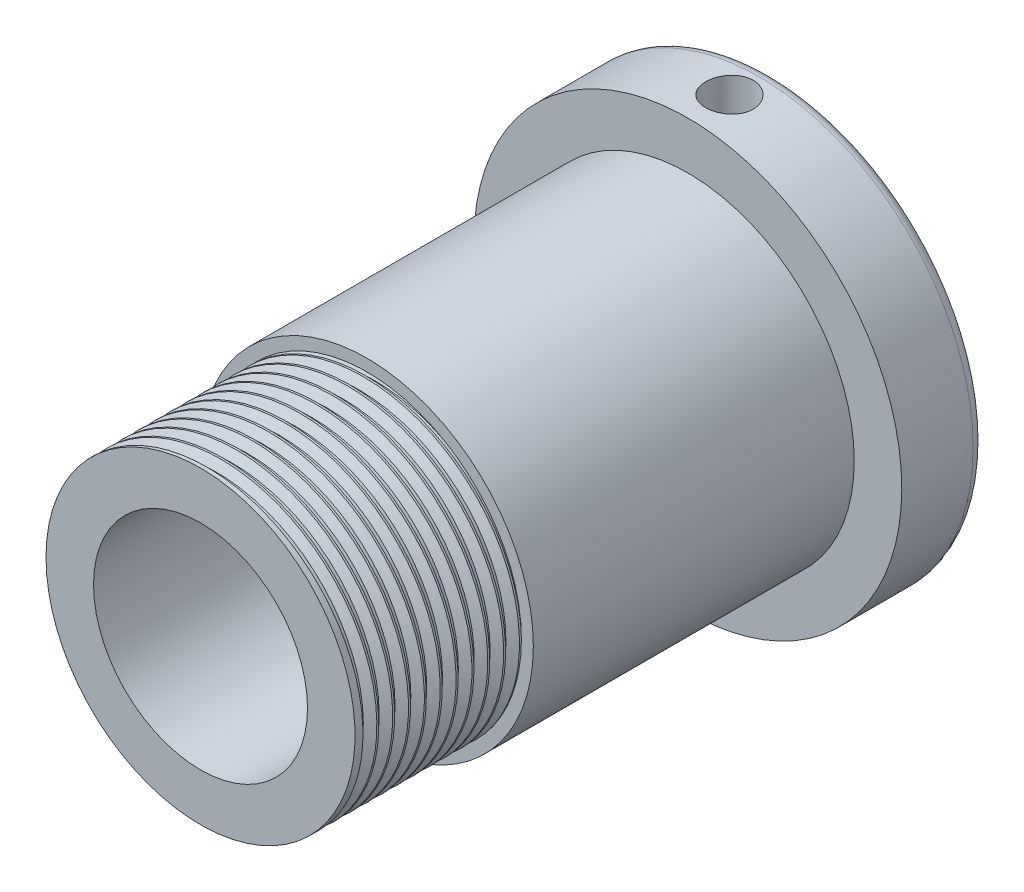
from build123d import *

# Parameters (mm, degrees)
SKETCH5_R          = 14.2875
CUT_EXTRUDE1_DEPTH = 87.252543441
SKETCH6_R          = 3.175
CUT_EXTRUDE2_DEPTH = 9.525
FILLET1_R          = 1.5875
THREAD1_PITCH      = 2.116666667


with BuildPart() as part:
    # Sketch1 → Revolve1 (revolve)
    with BuildSketch(Plane(origin=(0, 0, 0), x_dir=(0, 0, -1), z_dir=(1, 0, 0)), mode=Mode.PRIVATE) as revolve1_sk:
        Polygon((38.951396648, 28.575), (38.951396648, 0), (-37.248603352, 0), (-37.248603352, 20.6375), (-15.023603352, 20.6375), (-15.023603352, 22.225), (27.838896648, 22.225), (27.838896648, 28.575), align=None)
    revolve(revolve1_sk.sketch.rotate(Axis((0, 0, 27.688128492), (0, 0, -1)), 90), axis=Axis((0, 0, 27.688128492), (0, 0, -1)))

    # Sketch5 → Cut-Extrude1 (cut, through all)
    with BuildSketch(Plane.XY.offset(37.248603352)):
        Circle(SKETCH5_R)
    extrude(amount=-CUT_EXTRUDE1_DEPTH, mode=Mode.SUBTRACT)

    # Sketch6 → Cut-Extrude2 (cut)
    with BuildSketch(Plane(origin=(0, 28.575, 0), x_dir=(1, 0, 0), z_dir=(0, 1, 0))):
        with Locations(Location((0, 33.395146648, 0), (0, 0, 270))):
            Circle(SKETCH6_R)
    extrude(amount=-CUT_EXTRUDE2_DEPTH, mode=Mode.SUBTRACT)

    # Fillet1
    fillet1_edges = [part.edges().sort_by_distance(p)[0] for p in [
        (-28.575, 0, -38.951396648),
    ]]
    fillet(fillet1_edges, radius=FILLET1_R)

    # Thread1: the profile of Thread Profile1 profile screwed along a right-hand helix of 10.5 turns, 10 arcs to a turn; built about Z, then put on its axis
    thread1_z = Axis((0, 0, 0), (0, 0, 1))
    thread1_corners = [(20.6378, 0, -0.000173205), (20.6378, 0, 1.852256533), (19.491820565, 0, 1.190624997), (19.491820565, 0, 0.66145833)]
    with BuildLine(mode=Mode.PRIVATE) as thread1_profile:
        Line(thread1_corners[0], thread1_corners[1])
        Line(thread1_corners[1], thread1_corners[2])
        Line(thread1_corners[2], thread1_corners[3])
        Line(thread1_corners[3], thread1_corners[0])
    thread1_cap = Face(thread1_profile.wire())
    thread1_turn_angles = [0, 18, 36, 54, 72, 90, 108, 126, 144, 162, 180, 198, 216, 234, 252, 270, 288, 306, 324, 342, 360]
    thread1_turn_weights = [1, 0.9510565162951535, 1, 0.9510565162951535, 1, 0.9510565162951535, 1, 0.9510565162951535, 1, 0.9510565162951535, 1, 0.9510565162951535, 1, 0.9510565162951535, 1, 0.9510565162951535, 1, 0.9510565162951535, 1, 0.9510565162951535, 1]
    thread1_turn_rails = [Edge.make_bspline([Vector(p[0], p[1], 0).rotate(thread1_z, thread1_turn_angles[k]) / thread1_turn_weights[k] + Vector(0, 0, p[2] + THREAD1_PITCH * thread1_turn_angles[k] / 360) for k in range(21)], [0, 0, 0, 1, 1, 2, 2, 3, 3, 4, 4, 5, 5, 6, 6, 7, 7, 8, 8, 9, 9, 10, 10, 10], 2, thread1_turn_weights) for p in thread1_corners]
    thread1_turn_sides = [Face.make_surface_from_curves(thread1_turn_rails[p[0]], thread1_turn_rails[p[1]]) for p in [(0, 1), (1, 2), (2, 3), (3, 0)]]
    thread1_last_angles = [3600, 3618, 3636, 3654, 3672, 3690, 3708, 3726, 3744, 3762, 3780]
    thread1_last_weights = [1, 0.9510565162951535, 1, 0.9510565162951535, 1, 0.9510565162951535, 1, 0.9510565162951535, 1, 0.9510565162951523, 1]
    thread1_last_rails = [Edge.make_bspline([Vector(p[0], p[1], 0).rotate(thread1_z, thread1_last_angles[k]) / thread1_last_weights[k] + Vector(0, 0, p[2] + THREAD1_PITCH * thread1_last_angles[k] / 360) for k in range(11)], [0, 0, 0, 1, 1, 2, 2, 3, 3, 4, 4, 5, 5, 5], 2, thread1_last_weights) for p in thread1_corners]
    thread1_last_sides = [Face.make_surface_from_curves(thread1_last_rails[p[0]], thread1_last_rails[p[1]]) for p in [(0, 1), (1, 2), (2, 3), (3, 0)]]
    thread1 = Plane(origin=(0, 0, 37.248603352), x_dir=(-1, 0, 0), z_dir=(0, 0, -1)) * Solid(Shell([*[p.moved(Location((0, 0, THREAD1_PITCH * i))) for i in range(10) for p in thread1_turn_sides], *thread1_last_sides, thread1_cap, thread1_cap.rotate(thread1_z, 3780).moved(Location((0, 0, THREAD1_PITCH * 3780 / 360)))]))
    add(thread1, mode=Mode.SUBTRACT)


solid = part.part
